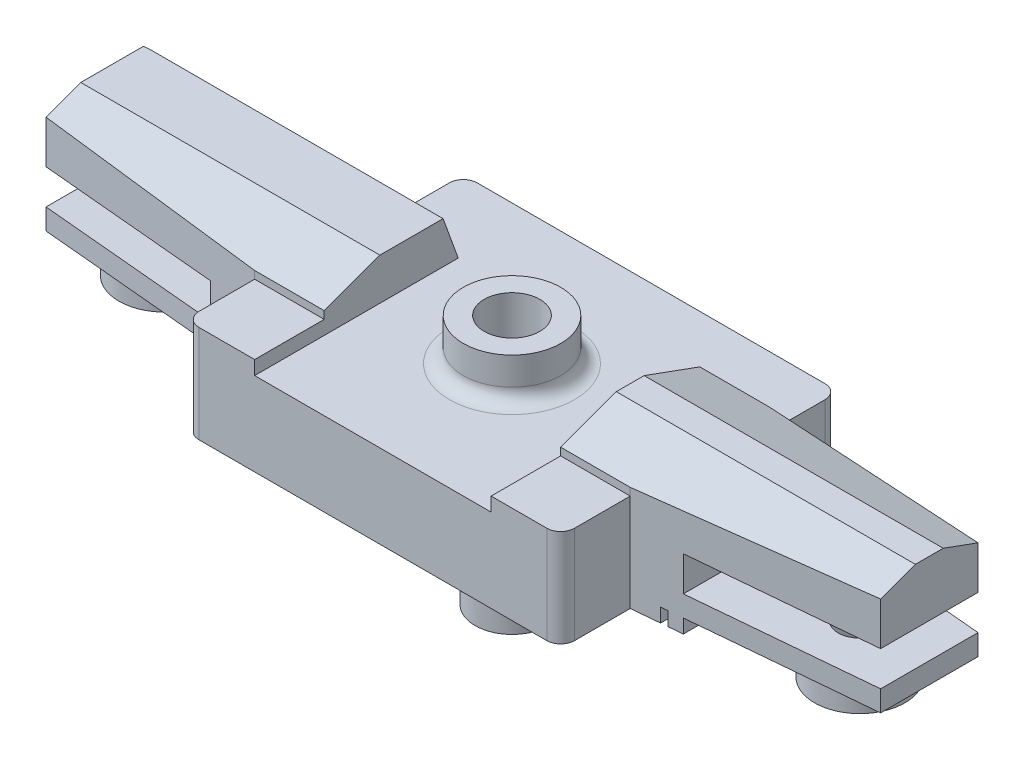
from build123d import *

# Parameters (mm, degrees)
SKETCH2_W           = 30
SKETCH2_H           = 10
SKETCH2_R           = 1
BOSS_EXTRUDE1_DEPTH = 4.5
CUT_EXTRUDE1_START  = -1.5
SKETCH3_W           = 2.5
SKETCH3_H           = 2.5
SKETCH3_R           = 1.75
SKETCH3_R_2         = 1
CUT_EXTRUDE1_DEPTH  = 1.5
CUT_EXTRUDE2_DEPTH  = 17.439282223
SKETCH6_W           = 0.25
SKETCH6_H           = 0.5
SKETCH6_W_2         = 6.5
SKETCH6_H_2         = 1.25
CUT_EXTRUDE4_DEPTH  = 9.5
SKETCH7_R           = 1.625
SKETCH7_R_2         = 1
SKETCH7_R_3         = 0.5
BOSS_EXTRUDE2_DEPTH = 1
SKETCH38_W          = 2.5
SKETCH38_H          = 2.5
BOSS_EXTRUDE3_DEPTH = 1.5
SKETCH39_W          = 2.5
SKETCH39_H          = 2.5
CUT_EXTRUDE7_DEPTH  = 1
CHAMFER3_SIZE       = 2
CHAMFER3_SIZE_2     = 0.727940469
SKETCH41_R          = 1.4
SKETCH41_R_2        = 1
EXTRUDE_THIN1_DEPTH = 4.5
EXTRUDE_THIN1_DRAFT = 1
FILLET3_R           = 0.5
CUT_EXTRUDE5_DEPTH  = 2
SKETCH37_R          = 0.5
CUT_EXTRUDE6_DEPTH  = 6
FILLET1_R           = 0.5
CHAMFER2_SIZE       = 0.5


with BuildPart() as part:
    # Sketch2 → Boss-Extrude1 (new body)
    with BuildSketch(Plane(origin=(0, 0, 0), x_dir=(1, 0, 0), z_dir=(0, 1, 0))):
        Rectangle(SKETCH2_W, SKETCH2_H)
        with Locations(Location((0, 0, 0), (0, 0, 270))):
            Circle(SKETCH2_R, mode=Mode.SUBTRACT)
    extrude(amount=BOSS_EXTRUDE1_DEPTH)

    # Sketch3 → Cut-Extrude1 (cut)
    # profile 1 of 5: a face of its own
    with BuildSketch(Plane(origin=(0, 4.5, 0), x_dir=(1, 0, 0), z_dir=(0, 1, 0)).offset(CUT_EXTRUDE1_START)):
        with Locations((-5.5, 3.75)):
            Rectangle(SKETCH3_W, SKETCH3_H)
    # profile 2 of 5: a face of its own
    with BuildSketch(Plane(origin=(0, 4.5, 0), x_dir=(1, 0, 0), z_dir=(0, 1, 0)).offset(CUT_EXTRUDE1_START)):
        with Locations((5.5, 3.75)):
            Rectangle(SKETCH3_W, SKETCH3_H)
    # profile 3 of 5: a face of its own
    with BuildSketch(Plane(origin=(0, 4.5, 0), x_dir=(1, 0, 0), z_dir=(0, 1, 0)).offset(CUT_EXTRUDE1_START)):
        Polygon((4.25, 5), (-4.25, 5), (-4.25, 2.5), (-4.25, -5), (4.25, -5), (4.25, -2.5), (4.25, 2.5), align=None)
        with Locations(Location((0, 0, 0), (0, 0, 270))):
            Circle(SKETCH3_R, mode=Mode.SUBTRACT)
    # profile 4 of 5: a face of its own
    with BuildSketch(Plane(origin=(0, 4.5, 0), x_dir=(1, 0, 0), z_dir=(0, 1, 0)).offset(CUT_EXTRUDE1_START)):
        with Locations(Location((0, 0, 0), (0, 0, 270))):
            Circle(SKETCH3_R_2)
    # profile 5 of 5: a face of its own
    with BuildSketch(Plane(origin=(0, 4.5, 0), x_dir=(1, 0, 0), z_dir=(0, 1, 0)).offset(CUT_EXTRUDE1_START)):
        with Locations((5.5, -3.75)):
            Rectangle(SKETCH3_W, SKETCH3_H)
    extrude(amount=CUT_EXTRUDE1_DEPTH, mode=Mode.SUBTRACT)

    # Sketch4 → Cut-Extrude2 (cut, through all)
    with BuildSketch(Plane(origin=(0, 4.5, 0), x_dir=(1, 0, 0), z_dir=(0, 1, 0))):
        Polygon((-6.75, 5), (-6.75, 2.5), (-15, 1.75), (-15, 5), align=None)
        Polygon((6.75, -5), (6.75, -2.5), (15, -1.75), (15, -5), align=None)
        Polygon((15, 5), (6.75, 5), (6.75, 2.5), (15, 1.75), align=None)
        Polygon((-15, -1.75), (-15, -5), (-6.75, -5), (-6.75, -2.5), align=None)
    extrude(amount=-CUT_EXTRUDE2_DEPTH, mode=Mode.SUBTRACT)

    # Sketch6 → Cut-Extrude4 (cut, symmetric)
    with BuildSketch(Plane.XY):
        with Locations((-7.875, 0.25)):
            Rectangle(SKETCH6_W, SKETCH6_H)
        with Locations((-11.75, 0.25)):
            Rectangle(SKETCH6_W_2, SKETCH6_H)
        with Locations((-11.75, 1.875)):
            Rectangle(SKETCH6_W_2, SKETCH6_H_2)
    cut_extrude4 = extrude(amount=CUT_EXTRUDE4_DEPTH, both=True, mode=Mode.SUBTRACT)

    # Sketch7 → Boss-Extrude2 (add)
    # profile 1 of 3: a face of its own
    with BuildSketch(Plane.XZ.offset(-0.5)):
        with Locations(Location((-12.5, 0, 0), (0, 0, 180))):
            Circle(SKETCH7_R)
    # profile 2 of 3: a face of its own
    with BuildSketch(Plane.XZ.offset(-0.5)):
        with Locations(Location((-3, 3, 0), (0, 0, 90))):
            Circle(SKETCH7_R_2)
        with Locations(Location((-3, 3, 0), (0, 0, 90))):
            Circle(SKETCH7_R_3, mode=Mode.SUBTRACT)
    # profile 3 of 3: a face of its own
    with BuildSketch(Plane.XZ.offset(-0.5)):
        with Locations(Location((-3, -3, 0), (0, 0, 90))):
            Circle(SKETCH7_R_2)
        with Locations(Location((-3, -3, 0), (0, 0, 90))):
            Circle(SKETCH7_R_3, mode=Mode.SUBTRACT)
    boss_extrude2 = extrude(amount=BOSS_EXTRUDE2_DEPTH)

    # Sketch9 → Ø1.55 (1.55) Diameter Hole2 (revolve, cut)
    with BuildSketch(Plane(origin=(-12.5, -0.5, 0), x_dir=(0, 0, -1), z_dir=(1, 0, 0))):
        Polygon((0, 0), (0, 3), (0.775, 2.53433302), (0.775, 0), align=None)
    f_1_55_1_55_diameter_hole2 = revolve(axis=Axis((-12.5, -6.85, 0), (0, 1, 0)), mode=Mode.SUBTRACT)

    # Sketch38 → Boss-Extrude3 (add)
    with BuildSketch(Plane(origin=(0, 3, 0), x_dir=(1, 0, 0), z_dir=(0, 1, 0))):
        with Locations((5.5, -3.75)):
            Rectangle(SKETCH38_W, SKETCH38_H)
    extrude(amount=BOSS_EXTRUDE3_DEPTH)

    # Sketch39 → Cut-Extrude7 (cut)
    with BuildSketch(Plane(origin=(0, 4.5, 0), x_dir=(1, 0, 0), z_dir=(0, 1, 0))):
        with Locations((5.5, -3.75)):
            Rectangle(SKETCH39_W, SKETCH39_H)
        with Locations((-5.5, -3.75)):
            Rectangle(SKETCH39_W, SKETCH39_H)
    extrude(amount=-CUT_EXTRUDE7_DEPTH, mode=Mode.SUBTRACT)

    # Chamfer3
    # the kernel refuses this chamfer: 2, 0.727940469 mm, written as the material it takes off along each edge
    with BuildSketch(Plane(origin=(32.691947326, 4.5, 2.5), x_dir=(0, 0, -1), z_dir=(-1, 0, 0))) as chamfer3_piece_1:
        Polygon((CHAMFER3_SIZE, 0), (0, CHAMFER3_SIZE_2), (0, 0), align=None)
    extrude(amount=28.441947326, mode=Mode.SUBTRACT)
    with BuildSketch(Plane(origin=(4.25, 4.5, -2.5), x_dir=(0, -1, 0), z_dir=(1, 0, 0))) as chamfer3_piece_2:
        Polygon((CHAMFER3_SIZE_2, 0), (0, -CHAMFER3_SIZE), (0, 0), align=None)
    extrude(amount=28.441947326, mode=Mode.SUBTRACT)
    with BuildSketch(Plane(origin=(-32.691947326, 4.5, 2.5), x_dir=(0, 0, -1), z_dir=(1, 0, 0))) as chamfer3_piece_3:
        Polygon((CHAMFER3_SIZE, 0), (0, -CHAMFER3_SIZE_2), (0, 0), align=None)
    extrude(amount=28.441947326, mode=Mode.SUBTRACT)
    with BuildSketch(Plane(origin=(-15.570262091, 4.5, -2.5), x_dir=(0, -1, 0), z_dir=(1, 0, 0))) as chamfer3_piece_4_section:
        Polygon((CHAMFER3_SIZE, 0), (0, -CHAMFER3_SIZE_2), (0, 0), align=None)
    chamfer3_piece_4 = extrude(amount=16.508651556, mode=Mode.PRIVATE)
    chamfer3_piece_4 = split(chamfer3_piece_4, bisect_by=Plane(origin=(-15.570262091, 3, -2.5), z_dir=(0, 1, 0)), keep=Keep.TOP, mode=Mode.PRIVATE)
    add(chamfer3_piece_4, mode=Mode.SUBTRACT)

    # Mirror1: Cut-Extrude4, Boss-Extrude2, Ø1.55 (1.55) Diameter Hole2 across plane
    add(cut_extrude4.mirror(Plane(origin=(0, 0, 0), x_dir=(0, 0, 1), z_dir=(1, 0, 0))), mode=Mode.SUBTRACT)
    add(boss_extrude2.mirror(Plane(origin=(0, 0, 0), x_dir=(0, 0, 1), z_dir=(1, 0, 0))))
    add(f_1_55_1_55_diameter_hole2.mirror(Plane(origin=(0, 0, 0), x_dir=(0, 0, 1), z_dir=(1, 0, 0))), mode=Mode.SUBTRACT)


with BuildPart() as extrude_thin1_tool:
    # Sketch41 → Extrude-Thin1 (with draft: the straight prism first)
    with BuildSketch(Plane.XZ):
        Circle(SKETCH41_R)
        Circle(SKETCH41_R_2, mode=Mode.SUBTRACT)
    extrude(amount=EXTRUDE_THIN1_DEPTH)
    # Extrude-Thin1: the draft: its side faces are tilted about the plane it starts from
    extrude_thin1_sides = [extrude_thin1_tool.faces().sort_by_distance(p)[0] for p in [
        (-1.4, -2.25, 0),
        (-1, -2.25, 0),
    ]]
    draft(extrude_thin1_sides, Plane.XZ, EXTRUDE_THIN1_DRAFT)


with BuildPart() as part_1:
    add(part.part)

    # Extrude-Thin1: add extrude_thin1_tool
    add(extrude_thin1_tool.part)

    # Fillet3
    fillet3_edges = [part_1.edges().sort_by_distance(p)[0] for p in [
        (-1.4, 0, 0),
        (-6.75, 1.75, 5),
        (6.75, 1.75, 5),
        (6.75, 1.5, -5),
        (-6.75, 1.5, -5),
    ]]
    fillet(fillet3_edges, radius=FILLET3_R)

    # Sketch36 → Cut-Extrude5 (cut)
    with BuildSketch(Plane.XZ):
        with BuildLine():
            Line((2, 1.5), (2, -1.5))
            ThreePointArc((2, -1.5), (0, -3.5), (-2, -1.5))
            Line((-2, -1.5), (-2, 1.5))
            ThreePointArc((-2, 1.5), (0, 3.5), (2, 1.5))
        make_face()
    extrude(amount=-CUT_EXTRUDE5_DEPTH, mode=Mode.SUBTRACT)


with BuildPart() as cut_extrude5_piece_1:
    # of the separate pieces the step leaves, piece 1, a body of its own (cut_extrude5_pieces)
    add(part_1.part.solids().sort_by_distance((-6.25, 0, -5))[0])

    # Sketch37 → Cut-Extrude6 (cut, symmetric)
    with BuildSketch(Plane(origin=(0, 0, 0), x_dir=(0, 0, -1), z_dir=(1, 0, 0))):
        with Locations((0, 1)):
            Circle(SKETCH37_R)
    extrude(amount=CUT_EXTRUDE6_DEPTH, both=True, mode=Mode.SUBTRACT)

    # Fillet1
    fillet1_edges = [cut_extrude5_piece_1.edges().sort_by_distance(p)[0] for p in [
        (0, 3, -1.75),
    ]]
    fillet(fillet1_edges, radius=FILLET1_R)

    # Chamfer2
    chamfer2_edges = [cut_extrude5_piece_1.edges().sort_by_distance(p)[0] for p in [
        (0, 2, -1),
    ]]
    chamfer(chamfer2_edges, length=CHAMFER2_SIZE)


with BuildPart() as cut_extrude5_piece_2:
    # of the separate pieces the step leaves, piece 2, a body of its own (cut_extrude5_pieces)
    add(part_1.part.solids().sort_by_distance((1.891348632, 0, 0))[0])


solid = Compound([cut_extrude5_piece_1.part, cut_extrude5_piece_2.part])
